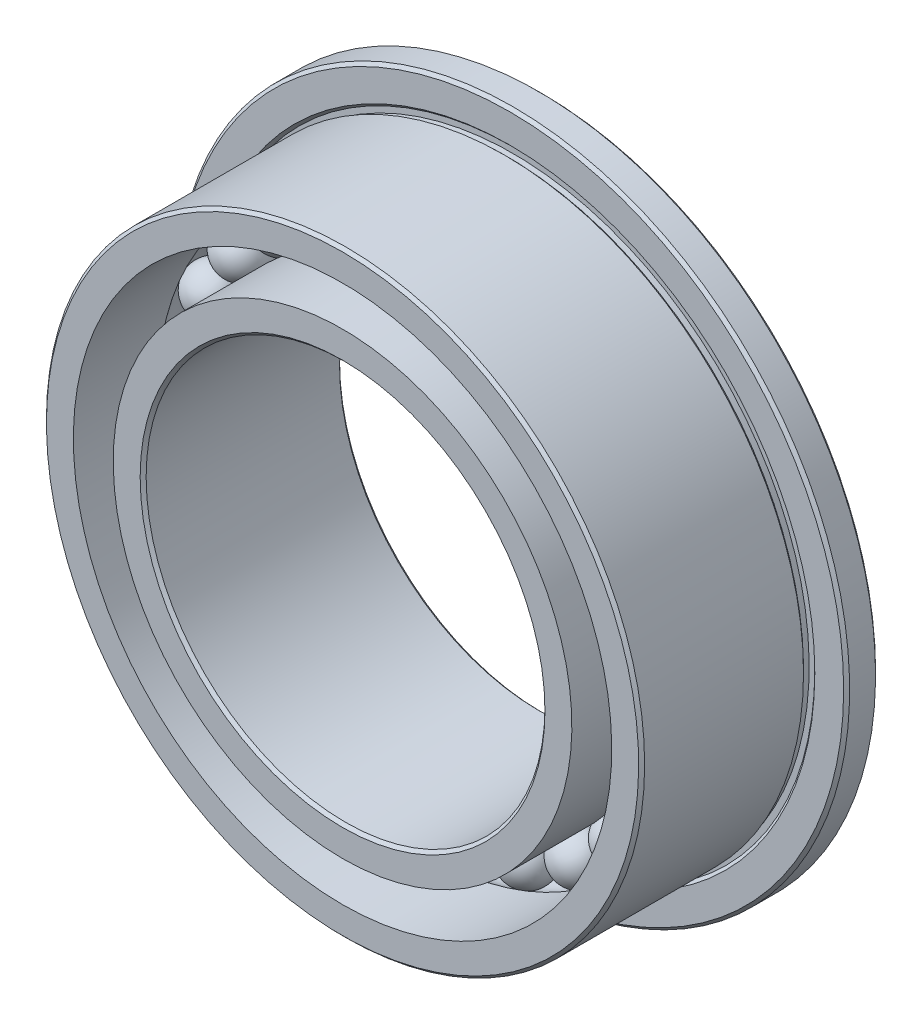
from build123d import *

# Parameters (mm, degrees)
FILLET1_SIZE      = 0.047625
FILLET2_SIZE      = 0.047625
CIRPATTERN3_COUNT = 27


with BuildPart() as part:
    # Sketch2 → Revolve1 (revolve)
    with BuildSketch(Plane(origin=(0, 0, 0), x_dir=(0, 0, -1), z_dir=(1, 0, 0))):
        with BuildLine():
            Line((1.5875, 5.3594), (1.0795, 5.3594))
            Line((1.0795, 5.3594), (1.0795, 4.852302561))
            Line((1.0795, 4.852302561), (1.124401281, 4.807401281))
            Line((1.124401281, 4.807401281), (1.124401281, 4.717598719))
            Line((1.124401281, 4.717598719), (1.034598719, 4.717598719))
            Line((1.034598719, 4.717598719), (0.989697439, 4.7625))
            Line((0.989697439, 4.7625), (-1.5875, 4.7625))
            Line((-1.5875, 4.7625), (-1.5875, 4.28625))
            Line((-1.5875, 4.28625), (-0.238125, 4.28625))
            ThreePointArc((-0.238125, 4.28625), (0, 4.365625), (0.238125, 4.28625))
            Line((0.238125, 4.28625), (1.5875, 4.28625))
            Line((1.5875, 4.28625), (1.5875, 5.3594))
        make_face()
        with BuildLine():
            Line((1.5875, 3.175), (-1.5875, 3.175))
            Line((-1.5875, 3.175), (-1.5875, 3.65125))
            Line((-1.5875, 3.65125), (-0.238125, 3.65125))
            ThreePointArc((-0.238125, 3.65125), (0, 3.571875), (0.238125, 3.65125))
            Line((0.238125, 3.65125), (1.5875, 3.65125))
            Line((1.5875, 3.65125), (1.5875, 3.175))
        make_face()
    revolve(axis=Axis((0, 0, 0), (0, 0, -1)))

    # Fillet1
    fillet1_edges = [part.edges().sort_by_distance(p)[0] for p in [
        (0, -5.3594, -1.5875),
        (0, -5.3594, -1.0795),
        (0, -4.7625, 1.5875),
    ]]
    chamfer(fillet1_edges, length=FILLET1_SIZE)

    # Fillet2
    fillet2_edges = [part.edges().sort_by_distance(p)[0] for p in [
        (0, -3.175, -1.5875),
        (0, -3.175, 1.5875),
    ]]
    chamfer(fillet2_edges, length=FILLET2_SIZE)


with BuildPart() as body_2:
    # Sketch7 → Revolve3 (revolve)
    with BuildSketch(Plane.XY):
        with BuildLine():
            Line((0, 4.365625), (0, 3.571875))
            ThreePointArc((0, 3.571875), (-0.396875, 3.96875), (0, 4.365625))
        make_face()
    revolve(axis=Axis((0, 4.365625, 0), (0, -1, 0)))


with BuildPart() as cirpattern3_1:
    # CirPattern3: pattern copy
    add(body_2.part.rotate(Axis((0, 0, 0), (0, 0, -1)), 1 * 360 / CIRPATTERN3_COUNT))


with BuildPart() as cirpattern3_2:
    # CirPattern3: pattern copy
    add(body_2.part.rotate(Axis((0, 0, 0), (0, 0, -1)), 2 * 360 / CIRPATTERN3_COUNT))


with BuildPart() as cirpattern3_3:
    # CirPattern3: pattern copy
    add(body_2.part.rotate(Axis((0, 0, 0), (0, 0, -1)), 3 * 360 / CIRPATTERN3_COUNT))


with BuildPart() as cirpattern3_4:
    # CirPattern3: pattern copy
    add(body_2.part.rotate(Axis((0, 0, 0), (0, 0, -1)), 4 * 360 / CIRPATTERN3_COUNT))


with BuildPart() as cirpattern3_5:
    # CirPattern3: pattern copy
    add(body_2.part.rotate(Axis((0, 0, 0), (0, 0, -1)), 5 * 360 / CIRPATTERN3_COUNT))


with BuildPart() as cirpattern3_6:
    # CirPattern3: pattern copy
    add(body_2.part.rotate(Axis((0, 0, 0), (0, 0, -1)), 6 * 360 / CIRPATTERN3_COUNT))


with BuildPart() as cirpattern3_7:
    # CirPattern3: pattern copy
    add(body_2.part.rotate(Axis((0, 0, 0), (0, 0, -1)), 7 * 360 / CIRPATTERN3_COUNT))


with BuildPart() as cirpattern3_8:
    # CirPattern3: pattern copy
    add(body_2.part.rotate(Axis((0, 0, 0), (0, 0, -1)), 8 * 360 / CIRPATTERN3_COUNT))


with BuildPart() as cirpattern3_9:
    # CirPattern3: pattern copy
    add(body_2.part.rotate(Axis((0, 0, 0), (0, 0, -1)), 9 * 360 / CIRPATTERN3_COUNT))


with BuildPart() as cirpattern3_10:
    # CirPattern3: pattern copy
    add(body_2.part.rotate(Axis((0, 0, 0), (0, 0, -1)), 10 * 360 / CIRPATTERN3_COUNT))


with BuildPart() as cirpattern3_11:
    # CirPattern3: pattern copy
    add(body_2.part.rotate(Axis((0, 0, 0), (0, 0, -1)), 11 * 360 / CIRPATTERN3_COUNT))


with BuildPart() as cirpattern3_12:
    # CirPattern3: pattern copy
    add(body_2.part.rotate(Axis((0, 0, 0), (0, 0, -1)), 12 * 360 / CIRPATTERN3_COUNT))


with BuildPart() as cirpattern3_13:
    # CirPattern3: pattern copy
    add(body_2.part.rotate(Axis((0, 0, 0), (0, 0, -1)), 13 * 360 / CIRPATTERN3_COUNT))


with BuildPart() as cirpattern3_14:
    # CirPattern3: pattern copy
    add(body_2.part.rotate(Axis((0, 0, 0), (0, 0, -1)), 14 * 360 / CIRPATTERN3_COUNT))


with BuildPart() as cirpattern3_15:
    # CirPattern3: pattern copy
    add(body_2.part.rotate(Axis((0, 0, 0), (0, 0, -1)), 15 * 360 / CIRPATTERN3_COUNT))


with BuildPart() as cirpattern3_16:
    # CirPattern3: pattern copy
    add(body_2.part.rotate(Axis((0, 0, 0), (0, 0, -1)), 16 * 360 / CIRPATTERN3_COUNT))


with BuildPart() as cirpattern3_17:
    # CirPattern3: pattern copy
    add(body_2.part.rotate(Axis((0, 0, 0), (0, 0, -1)), 17 * 360 / CIRPATTERN3_COUNT))


with BuildPart() as cirpattern3_18:
    # CirPattern3: pattern copy
    add(body_2.part.rotate(Axis((0, 0, 0), (0, 0, -1)), 18 * 360 / CIRPATTERN3_COUNT))


with BuildPart() as cirpattern3_19:
    # CirPattern3: pattern copy
    add(body_2.part.rotate(Axis((0, 0, 0), (0, 0, -1)), 19 * 360 / CIRPATTERN3_COUNT))


with BuildPart() as cirpattern3_20:
    # CirPattern3: pattern copy
    add(body_2.part.rotate(Axis((0, 0, 0), (0, 0, -1)), 20 * 360 / CIRPATTERN3_COUNT))


with BuildPart() as cirpattern3_21:
    # CirPattern3: pattern copy
    add(body_2.part.rotate(Axis((0, 0, 0), (0, 0, -1)), 21 * 360 / CIRPATTERN3_COUNT))


with BuildPart() as cirpattern3_22:
    # CirPattern3: pattern copy
    add(body_2.part.rotate(Axis((0, 0, 0), (0, 0, -1)), 22 * 360 / CIRPATTERN3_COUNT))


with BuildPart() as cirpattern3_23:
    # CirPattern3: pattern copy
    add(body_2.part.rotate(Axis((0, 0, 0), (0, 0, -1)), 23 * 360 / CIRPATTERN3_COUNT))


with BuildPart() as cirpattern3_24:
    # CirPattern3: pattern copy
    add(body_2.part.rotate(Axis((0, 0, 0), (0, 0, -1)), 24 * 360 / CIRPATTERN3_COUNT))


with BuildPart() as cirpattern3_25:
    # CirPattern3: pattern copy
    add(body_2.part.rotate(Axis((0, 0, 0), (0, 0, -1)), 25 * 360 / CIRPATTERN3_COUNT))


with BuildPart() as cirpattern3_26:
    # CirPattern3: pattern copy
    add(body_2.part.rotate(Axis((0, 0, 0), (0, 0, -1)), 26 * 360 / CIRPATTERN3_COUNT))


solid = Compound([part.part, body_2.part, cirpattern3_1.part, cirpattern3_2.part, cirpattern3_3.part, cirpattern3_4.part, cirpattern3_5.part, cirpattern3_6.part, cirpattern3_7.part, cirpattern3_8.part, cirpattern3_9.part, cirpattern3_10.part, cirpattern3_11.part, cirpattern3_12.part, cirpattern3_13.part, cirpattern3_14.part, cirpattern3_15.part, cirpattern3_16.part, cirpattern3_17.part, cirpattern3_18.part, cirpattern3_19.part, cirpattern3_20.part, cirpattern3_21.part, cirpattern3_22.part, cirpattern3_23.part, cirpattern3_24.part, cirpattern3_25.part, cirpattern3_26.part])
